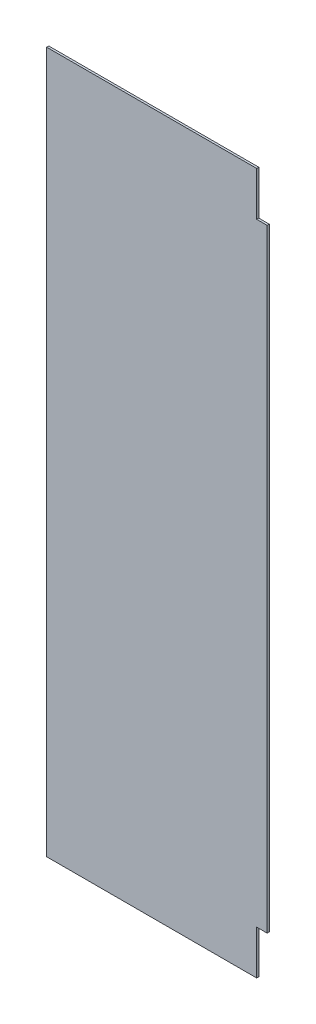
from build123d import *

# Parameters (mm, degrees)
EXTRUDE_1_DEPTH = 0.1


with BuildPart() as part:
    # Эскиз1 → Бобышка-Вытянуть1 (new body)
    with BuildSketch(Plane.XY):
        Polygon((23.5, 14.6), (24, 14.6), (24, -14.6), (23.5, -14.6), (23.5, -16.7), (13.5, -16.7), (13.5, 16.7), (23.5, 16.7), align=None)
    extrude(amount=EXTRUDE_1_DEPTH)


solid = part.part
